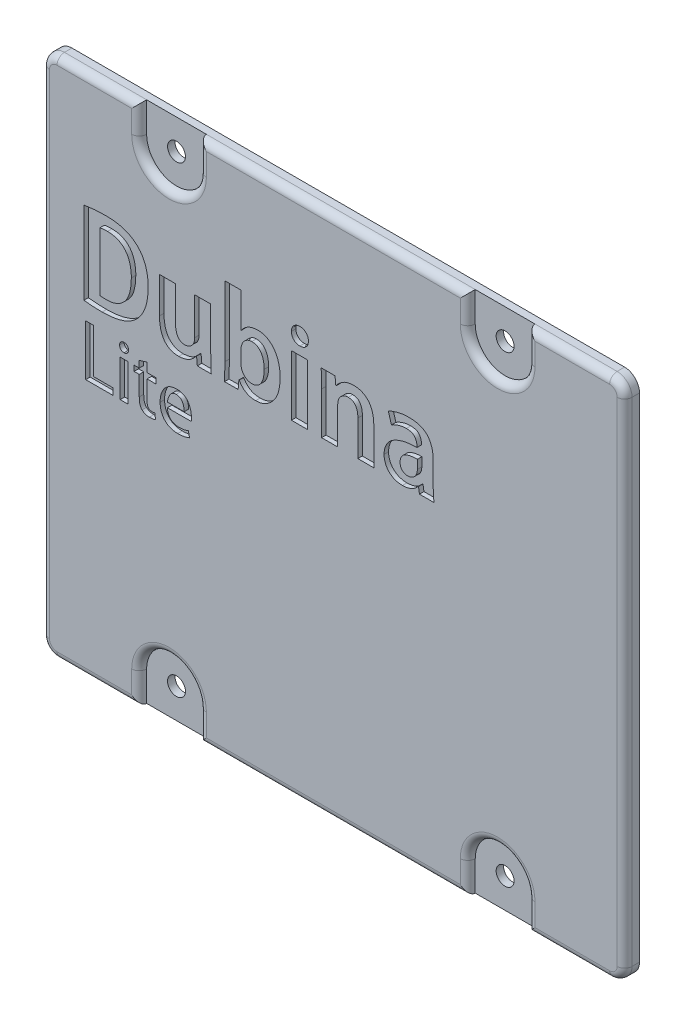
from build123d import *

# Parameters (mm, degrees)
EXTRUDE_1_DEPTH     = 2
SKETCH_2_3_R        = 1.2
EXTRUDE_2_DEPTH     = 1
FILLET_1_R          = 1
SKETCH_3_W          = 2.140804471
SKETCH_3_H          = 8.074367066
SKETCH_3_W_2        = 1.045585638
SKETCH_3_H_2        = 4.934335429
CUT_EXTRUDE_1_DEPTH = 0.6


with BuildPart() as part:
    # Эскиз2 → Бобышка-Вытянуть1 (new body)
    with BuildSketch(Plane.XY):
        with BuildLine():
            Line((-26, 35), (-37, 35))
            ThreePointArc((-37, 35), (-38.414213562, 34.414213562), (-39, 33))
            Line((-39, 33), (-39, -33))
            ThreePointArc((-39, -33), (-38.414213562, -34.414213562), (-37, -35))
            Line((-37, -35), (-26, -35))
            Line((-26, -35), (-26, -31))
            ThreePointArc((-26, -31), (-22, -27), (-18, -31))
            Line((-18, -31), (-18, -35))
            Line((-18, -35), (18, -35))
            Line((18, -35), (18, -31))
            ThreePointArc((18, -31), (22, -27), (26, -31))
            Line((26, -31), (26, -35))
            Line((26, -35), (37, -35))
            ThreePointArc((37, -35), (38.414213562, -34.414213562), (39, -33))
            Line((39, -33), (39, 33))
            ThreePointArc((39, 33), (38.414213562, 34.414213562), (37, 35))
            Line((37, 35), (26, 35))
            Line((26, 35), (26, 31))
            ThreePointArc((26, 31), (22, 27), (18, 31))
            Line((18, 31), (18, 35))
            Line((18, 35), (-18, 35))
            Line((-18, 35), (-18, 31))
            ThreePointArc((-18, 31), (-22, 27), (-26, 31))
            Line((-26, 31), (-26, 35))
        make_face()
    extrude(amount=EXTRUDE_1_DEPTH)

    # Эскиз2<3> → Бобышка-Вытянуть2 (add)
    # profile 1 of 4: a face of its own
    with BuildSketch(Plane.XY):
        with BuildLine():
            Line((-26, -31), (-26, -35))
            Line((-26, -35), (-18, -35))
            Line((-18, -35), (-18, -31))
            ThreePointArc((-18, -31), (-22, -27), (-26, -31))
        make_face()
        with Locations((-22, -31)):
            Circle(SKETCH_2_3_R, mode=Mode.SUBTRACT)
    # profile 2 of 4: a face of its own
    with BuildSketch(Plane.XY):
        with BuildLine():
            Line((18, -31), (18, -35))
            Line((18, -35), (26, -35))
            Line((26, -35), (26, -31))
            ThreePointArc((26, -31), (22, -27), (18, -31))
        make_face()
        with Locations((22, -31)):
            Circle(SKETCH_2_3_R, mode=Mode.SUBTRACT)
    # profile 3 of 4: a face of its own
    with BuildSketch(Plane.XY):
        with BuildLine():
            Line((26, 35), (18, 35))
            Line((18, 35), (18, 31))
            ThreePointArc((18, 31), (22, 27), (26, 31))
            Line((26, 31), (26, 35))
        make_face()
        with Locations((22, 31)):
            Circle(SKETCH_2_3_R, mode=Mode.SUBTRACT)
    # profile 4 of 4: a face of its own
    with BuildSketch(Plane.XY):
        with BuildLine():
            Line((-18, 35), (-26, 35))
            Line((-26, 35), (-26, 31))
            ThreePointArc((-26, 31), (-22, 27), (-18, 31))
            Line((-18, 31), (-18, 35))
        make_face()
        with Locations((-22, 31)):
            Circle(SKETCH_2_3_R, mode=Mode.SUBTRACT)
    extrude(amount=EXTRUDE_2_DEPTH)

    # Скругление1
    fillet_1_edges = [part.edges().sort_by_distance(p)[0] for p in [
        (-31.5, 35, 2),
        (-26, 33, 2),
        (-22, 27, 2),
        (-18, 33, 2),
        (0, 35, 2),
        (18, 33, 2),
        (22, 27, 2),
        (26, 33, 2),
        (31.5, 35, 2),
        (39, 0, 2),
        (31.5, -35, 2),
        (26, -33, 2),
        (22, -27, 2),
        (18, -33, 2),
        (0, -35, 2),
        (-18, -33, 2),
        (-22, -27, 2),
        (-26, -33, 2),
        (-31.5, -35, 2),
        (-38.414213562, 34.414213562, 2),
        (38.414213562, 34.414213562, 2),
        (38.414213562, -34.414213562, 2),
        (-38.414213562, -34.414213562, 2),
        (-39, 0, 2),
    ]]
    fillet(fillet_1_edges, radius=FILLET_1_R - 0.0001)  # a hair under: the kernel refuses the full size

    # Эскиз3 → Вырез-Вытянуть1 (cut)
    # profile 1 of 12: a face of its own
    with BuildSketch(Plane.XY.offset(2)):
        with BuildLine():
            add(Edge.make_bspline(
                [(-33.393138538, 8.551452839), (-33.318030964, 8.541044655), (-33.159637509, 8.519094961), (-32.910901713, 8.492266855), (-32.63963818, 8.46970589), (-32.346804749, 8.448066403), (-32.032064953, 8.431786433), (-31.695602907, 8.418995646), (-31.338044059, 8.41123396), (-31.092197084, 8.407392867), (-30.965769964, 8.40541758)],
                knots=[0, 0, 0, 0, 0.747798485, 1.577023202, 2.466955376, 3.432305679, 4.472841868, 5.575028817, 6.752955478, 8, 8, 8, 8], degree=3))
            add(Edge.make_bspline(
                [(-30.965769964, 8.40541758), (-30.730327991, 8.409248475), (-30.271198838, 8.416719003), (-29.602997505, 8.480841027), (-28.973494521, 8.58450489), (-28.385542019, 8.733650196), (-27.838633629, 8.923449635), (-27.33908479, 9.161868004), (-26.879926511, 9.436459292), (-26.611943507, 9.661788615), (-26.479777506, 9.772918334)],
                knots=[0, 0, 0, 0, 1.17842423, 2.298013867, 3.356996017, 4.369259479, 5.331192529, 6.249700563, 7.136773321, 8, 8, 8, 8], degree=3))
            add(Edge.make_bspline(
                [(-26.479777506, 9.772918334), (-26.42442458, 9.822878728), (-26.311908631, 9.924433273), (-26.150554082, 10.091364319), (-25.998608994, 10.278053983), (-25.84656794, 10.477391819), (-25.708164035, 10.698774065), (-25.566686543, 10.932064415), (-25.435870065, 11.184966624), (-25.30797249, 11.4539149), (-25.188579404, 11.741663319), (-25.089502015, 12.053234884), (-24.999436099, 12.383830551), (-24.930132654, 12.736998966), (-24.869260561, 13.11056633), (-24.829989895, 13.506132916), (-24.798093338, 13.922693804), (-24.792673044, 14.207571767), (-24.789892136, 14.353729797)],
                knots=[0, 0, 0, 0, 0.711529635, 1.446327024, 2.212730038, 3.007707617, 3.836959069, 4.702581573, 5.611055214, 6.552559085, 7.54462654, 8.581167827, 9.670545423, 10.812911411, 12.014096724, 13.281372547, 14.605194915, 16, 16, 16, 16], degree=3))
            add(Edge.make_bspline(
                [(-24.789892136, 14.353729797), (-24.791799031, 14.47807321), (-24.795529354, 14.721317296), (-24.816289673, 15.079235854), (-24.852778376, 15.422842491), (-24.899650411, 15.752975283), (-24.963917224, 16.06843176), (-25.03926506, 16.369531355), (-25.127070629, 16.657084811), (-25.23109106, 16.929651274), (-25.347334081, 17.1887836), (-25.473260981, 17.436471654), (-25.612961956, 17.670153921), (-25.762456793, 17.892531842), (-25.924341095, 18.100999957), (-26.09895528, 18.29520502), (-26.281282549, 18.480377501), (-26.413560216, 18.592066442), (-26.479777506, 18.647977157)],
                knots=[0, 0, 0, 0, 1.250196122, 2.445668869, 3.60292861, 4.723409941, 5.796680955, 6.837975795, 7.843086112, 8.817515314, 9.76895262, 10.69744629, 11.609358382, 12.504409608, 13.39005195, 14.260302496, 15.129119398, 16, 16, 16, 16], degree=3))
            add(Edge.make_bspline(
                [(-26.479777506, 18.647977157), (-26.598595544, 18.742761407), (-26.83871198, 18.934308555), (-27.241309456, 19.174139821), (-27.679844374, 19.375887665), (-28.156207151, 19.54427422), (-28.675941132, 19.670995188), (-29.242198664, 19.76352234), (-29.857102303, 19.817302649), (-30.28366833, 19.824318113), (-30.504317475, 19.827946991)],
                knots=[0, 0, 0, 0, 0.850789701, 1.719339872, 2.61723906, 3.551911928, 4.545442216, 5.610282156, 6.763874371, 8, 8, 8, 8], degree=3))
            add(Edge.make_bspline(
                [(-30.504317475, 19.827946991), (-30.770593889, 19.82554478), (-31.290226405, 19.820856917), (-31.929365663, 19.77968562), (-32.416063916, 19.735990418), (-32.757845589, 19.692212876), (-33.082776308, 19.647512735), (-33.29280261, 19.610168021), (-33.395243569, 19.591953025)],
                knots=[0, 0, 0, 0, 1.650018419, 3.219974348, 3.967566001, 4.678084243, 5.355231624, 6, 6, 6, 6], degree=3))
            Line((-33.395243569, 19.591953025), (-33.393138538, 8.551452839))
        make_face()
        with BuildLine():
            add(Edge.make_bspline(
                [(-31.252334067, 18.031715359), (-31.188537733, 18.043403777), (-31.04826475, 18.06910383), (-30.815799289, 18.091651715), (-30.543982864, 18.111999216), (-30.349146054, 18.115253599), (-30.24514553, 18.116990732)],
                knots=[0, 0, 0, 0, 0.76869223, 1.690171609, 2.76705349, 4, 4, 4, 4], degree=3))
            add(Edge.make_bspline(
                [(-30.24514553, 18.116990732), (-30.123506281, 18.114287351), (-29.886406197, 18.109017902), (-29.541218959, 18.064340125), (-29.217170387, 17.989628458), (-28.911143589, 17.891430244), (-28.629459778, 17.752367435), (-28.364313148, 17.592107554), (-28.122506467, 17.397023439), (-27.900110499, 17.175580067), (-27.700699455, 16.922844384), (-27.527366677, 16.639200271), (-27.383809338, 16.324696505), (-27.258419619, 15.983399975), (-27.169902154, 15.609371275), (-27.098941346, 15.207888026), (-27.057524719, 14.775987263), (-27.050311522, 14.478132768), (-27.046584444, 14.324230551)],
                knots=[0, 0, 0, 0, 1.034636826, 2.016721417, 2.954616098, 3.861659027, 4.743652532, 5.62095741, 6.492606741, 7.379948462, 8.28614458, 9.224914536, 10.200706863, 11.223314941, 12.31319917, 13.465574242, 14.690455408, 16, 16, 16, 16], degree=3))
            add(Edge.make_bspline(
                [(-27.046584444, 14.324230551), (-27.050817963, 14.147139134), (-27.058997428, 13.804985752), (-27.104805999, 13.309910726), (-27.180807831, 12.852524884), (-27.280006469, 12.430208269), (-27.410534116, 12.045635918), (-27.568239793, 11.696457744), (-27.756104566, 11.385480056), (-27.970750393, 11.110458448), (-28.209820239, 10.872086589), (-28.468857931, 10.666230065), (-28.746478472, 10.491263748), (-29.046382057, 10.351984282), (-29.36531728, 10.24504382), (-29.703278376, 10.168424061), (-30.061427953, 10.126219447), (-30.306844506, 10.123889656), (-30.43267645, 10.122695106)],
                knots=[0, 0, 0, 0, 1.382790342, 2.671650606, 3.877892401, 5.000458499, 6.054825918, 7.043745429, 7.986092149, 8.88452668, 9.760866288, 10.615577842, 11.46308158, 12.316807429, 13.190810493, 14.084799087, 15.018022824, 16, 16, 16, 16], degree=3))
            add(Edge.make_bspline(
                [(-30.43267645, 10.122695106), (-30.507841092, 10.121089792), (-30.653306169, 10.117983051), (-30.86479072, 10.128225769), (-31.063247463, 10.141101133), (-31.190598922, 10.15850651), (-31.252334067, 10.166943975)],
                knots=[0, 0, 0, 0, 1.0974001, 2.123783006, 3.090481336, 4, 4, 4, 4], degree=3))
            Line((-31.252334067, 10.166943975), (-31.252334067, 18.031715359))
        make_face(mode=Mode.SUBTRACT)
    # profile 2 of 12: a face of its own
    with BuildSketch(Plane.XY.offset(2)):
        with BuildLine():
            Line((-18.559232052, 16.606207927), (-18.559232052, 11.63409728))
            add(Edge.make_bspline(
                [(-18.559232052, 11.63409728), (-18.566794255, 11.524487696), (-18.581277232, 11.314565676), (-18.660845772, 11.018992172), (-18.782919933, 10.756861624), (-18.955326415, 10.538607355), (-19.15803687, 10.361957412), (-19.38521809, 10.233382725), (-19.632676016, 10.151544277), (-19.80530386, 10.13940076), (-19.893017325, 10.133230551)],
                knots=[0, 0, 0, 0, 1.179015692, 2.25802659, 3.271398766, 4.266941286, 5.225354467, 6.145233723, 7.057579747, 8, 8, 8, 8], degree=3))
            add(Edge.make_bspline(
                [(-19.893017325, 10.133230551), (-19.946467553, 10.135725089), (-20.050450482, 10.140578003), (-20.201198575, 10.164542928), (-20.339343934, 10.210313415), (-20.46648561, 10.268846312), (-20.582271312, 10.34310891), (-20.68444158, 10.435638816), (-20.775736436, 10.544179259), (-20.854799433, 10.668921111), (-20.924534535, 10.806560652), (-20.983521503, 10.956904298), (-21.031291497, 11.120061309), (-21.071273992, 11.295295199), (-21.102480527, 11.483184493), (-21.125744487, 11.682834131), (-21.138586666, 11.895287153), (-21.138402192, 12.04083179), (-21.138306917, 12.11600129)],
                knots=[0, 0, 0, 0, 0.970111335, 1.887270113, 2.757316712, 3.600661993, 4.42030127, 5.241127285, 6.090797025, 6.984664766, 7.913162656, 8.885278701, 9.908852515, 10.993376472, 12.142964809, 13.361072668, 14.637072075, 16, 16, 16, 16], degree=3))
            Line((-21.138306917, 12.11600129), (-21.138306917, 16.606207927))
            Line((-21.138306917, 16.606207927), (-23.279111388, 16.606207927))
            Line((-23.279111388, 16.606207927), (-23.279111388, 11.798437875))
            add(Edge.make_bspline(
                [(-23.279111388, 11.798437875), (-23.277018338, 11.653441202), (-23.272979591, 11.373655786), (-23.232836744, 10.970507003), (-23.177514586, 10.597933484), (-23.100754041, 10.254884318), (-22.999729138, 9.943494991), (-22.880316945, 9.661178121), (-22.735956294, 9.411785225), (-22.573805862, 9.190064642), (-22.390230863, 9.0000533), (-22.194180569, 8.833953753), (-21.980901613, 8.695563214), (-21.752705793, 8.584295148), (-21.510440102, 8.496941726), (-21.253198083, 8.436283103), (-20.981375389, 8.39923432), (-20.794971837, 8.397746833), (-20.700032407, 8.396989224)],
                knots=[0, 0, 0, 0, 1.433410501, 2.765907269, 4.002642214, 5.156811599, 6.237479393, 7.236132151, 8.182067156, 9.08085115, 9.945465735, 10.788525471, 11.616923183, 12.452510876, 13.293966855, 14.15819078, 15.061926052, 16, 16, 16, 16], degree=3))
            add(Edge.make_bspline(
                [(-20.700032407, 8.396989224), (-20.623429128, 8.400455951), (-20.473439885, 8.407243803), (-20.254425478, 8.429787293), (-20.047014664, 8.466187848), (-19.851257026, 8.512056061), (-19.666290196, 8.568589772), (-19.493463968, 8.638812445), (-19.33078813, 8.717974047), (-19.135268096, 8.838003884), (-18.918779965, 8.998250895), (-18.690755445, 9.196593308), (-18.500965349, 9.398158919), (-18.40360824, 9.544670426), (-18.356949451, 9.61488666)],
                knots=[0, 0, 0, 0, 1.002239885, 1.962385977, 2.8755572, 3.752951768, 4.589276476, 5.400792547, 6.189126677, 6.951201867, 8.396379851, 9.703982279, 10.899624208, 12, 12, 12, 12], degree=3))
            Line((-18.356949451, 9.61488666), (-18.313315836, 9.616600727))
            Line((-18.313315836, 9.616600727), (-18.212056218, 8.531840861))
            Line((-18.212056218, 8.531840861), (-16.345607491, 8.531840861))
            add(Edge.make_bspline(
                [(-16.345607491, 8.531840861), (-16.355801559, 8.710912621), (-16.377180405, 9.086459228), (-16.396854909, 9.676595244), (-16.411283956, 10.31860388), (-16.417374397, 10.763946089), (-16.42053467, 10.995029948)],
                knots=[0, 0, 0, 0, 0.873285086, 1.831440378, 2.874754927, 4, 4, 4, 4], degree=3))
            Line((-16.42053467, 10.995029948), (-16.418429639, 16.606207927))
            Line((-16.418429639, 16.606207927), (-18.559232052, 16.606207927))
        make_face()
    # profile 3 of 12: a face of its own
    with BuildSketch(Plane.XY.offset(2)):
        with BuildLine():
            Line((-12.372816721, 20.247255643), (-14.513621192, 20.247255643))
            Line((-14.513621192, 20.247255643), (-14.513621192, 10.877677026))
            add(Edge.make_bspline(
                [(-14.513621192, 10.877677026), (-14.51522432, 10.660425309), (-14.518382581, 10.232425805), (-14.529502972, 9.704751272), (-14.540073498, 9.30228061), (-14.551269805, 9.025592372), (-14.561550927, 8.770623565), (-14.569036072, 8.607695166), (-14.572617626, 8.52973583)],
                knots=[0, 0, 0, 0, 1.664880021, 3.279918044, 4.044519703, 4.750125368, 5.401949591, 6, 6, 6, 6], degree=3))
            Line((-14.572617626, 8.52973583), (-12.748810701, 8.531840861))
            Line((-12.748810701, 8.531840861), (-12.647551083, 9.687478345))
            Line((-12.647551083, 9.687478345), (-12.604154104, 9.687478345))
            add(Edge.make_bspline(
                [(-12.604154104, 9.687478345), (-12.538992106, 9.579166388), (-12.413346963, 9.370319643), (-12.184990941, 9.098163985), (-11.936344518, 8.872241871), (-11.663183425, 8.696460389), (-11.37251717, 8.563028444), (-11.065488805, 8.470208177), (-10.743328738, 8.413782678), (-10.523024183, 8.408235407), (-10.411116872, 8.40541758)],
                knots=[0, 0, 0, 0, 1.131224551, 2.181223318, 3.170642443, 4.13078333, 5.079824189, 6.02748669, 6.998029518, 8, 8, 8, 8], degree=3))
            add(Edge.make_bspline(
                [(-10.411116872, 8.40541758), (-10.30419891, 8.408861133), (-10.092072629, 8.415693175), (-9.779109786, 8.464100568), (-9.476988904, 8.549970645), (-9.186010258, 8.668207299), (-8.904463009, 8.819490195), (-8.635388903, 9.005588363), (-8.376257626, 9.225503572), (-8.128019641, 9.476345175), (-7.900567959, 9.763352196), (-7.698217989, 10.083964801), (-7.528953964, 10.440632547), (-7.384927601, 10.828773232), (-7.274669489, 11.251956868), (-7.190766906, 11.707518464), (-7.136277157, 12.197687878), (-7.122652521, 12.535879337), (-7.115629693, 12.710200385)],
                knots=[0, 0, 0, 0, 0.847449944, 1.68134896, 2.502719537, 3.331902851, 4.166396421, 5.031225821, 5.920181802, 6.857197951, 7.824106615, 8.817361735, 9.855764383, 10.947927019, 12.09450585, 13.317559317, 14.617333883, 16, 16, 16, 16], degree=3))
            add(Edge.make_bspline(
                [(-7.115629693, 12.710200385), (-7.119543561, 12.856377627), (-7.127197481, 13.142240272), (-7.16715244, 13.560465746), (-7.232399201, 13.956698042), (-7.319876765, 14.331178463), (-7.433915057, 14.682988308), (-7.573508284, 15.0125614), (-7.735387073, 15.321236756), (-7.920622091, 15.60575603), (-8.125786594, 15.863641361), (-8.353020054, 16.088108946), (-8.596042058, 16.281481752), (-8.857042331, 16.441976248), (-9.138017105, 16.563766175), (-9.434881852, 16.654179148), (-9.749137578, 16.715982748), (-9.965522763, 16.725607956), (-10.076089723, 16.730526177)],
                knots=[0, 0, 0, 0, 1.258613326, 2.461330713, 3.613433494, 4.713391422, 5.768892021, 6.793100615, 7.791148573, 8.765544853, 9.711748599, 10.622452917, 11.509175615, 12.380257356, 13.252052325, 14.137599147, 15.048363683, 16, 16, 16, 16], degree=3))
            add(Edge.make_bspline(
                [(-10.076089723, 16.730526177), (-10.202020167, 16.726201539), (-10.44608576, 16.717819966), (-10.799628432, 16.661078785), (-11.125873524, 16.563934875), (-11.425956491, 16.430168221), (-11.697835953, 16.263280793), (-11.944437372, 16.066891127), (-12.162673919, 15.839053554), (-12.284296929, 15.666686928), (-12.345424564, 15.580055589)],
                knots=[0, 0, 0, 0, 1.137196293, 2.203998325, 3.223492524, 4.203095137, 5.162612269, 6.096781389, 7.043443732, 8, 8, 8, 8], degree=3))
            Line((-12.345424564, 15.580055589), (-12.372816721, 15.581650309))
            Line((-12.372816721, 15.581650309), (-12.372816721, 20.247255643))
        make_face()
        with BuildLine():
            add(Edge.make_bspline(
                [(-12.372816721, 13.308025155), (-12.369330119, 13.370785007), (-12.362503885, 13.493659197), (-12.340114966, 13.673826386), (-12.302137968, 13.844392841), (-12.251013147, 14.004688602), (-12.190875379, 14.156109073), (-12.114180522, 14.295466117), (-12.024853754, 14.425061704), (-11.892341848, 14.582234609), (-11.707320746, 14.748941772), (-11.46013863, 14.899506173), (-11.191312476, 14.991506668), (-11.004591856, 15.005963407), (-10.910496963, 15.013248651)],
                knots=[0, 0, 0, 0, 0.908426032, 1.778559225, 2.620947371, 3.430072183, 4.208687216, 4.971927617, 5.723807717, 6.480334157, 7.93974638, 9.30127749, 10.640021615, 12, 12, 12, 12], degree=3))
            add(Edge.make_bspline(
                [(-10.910496963, 15.013248651), (-10.842912833, 15.009105026), (-10.711760151, 15.001063974), (-10.521321705, 14.964694068), (-10.344522008, 14.907932865), (-10.179940664, 14.832301269), (-10.030575166, 14.732936962), (-9.893484555, 14.615177111), (-9.769752252, 14.476101573), (-9.661892416, 14.317684167), (-9.564335761, 14.145315872), (-9.483840331, 13.958513363), (-9.410340143, 13.762426676), (-9.35489295, 13.553224116), (-9.3104255, 13.333702181), (-9.27913688, 13.102851719), (-9.259893699, 12.860836653), (-9.257601182, 12.695487547), (-9.256432106, 12.611167203)],
                knots=[0, 0, 0, 0, 0.993416888, 1.927808926, 2.837694666, 3.714244227, 4.578022629, 5.462783605, 6.361142406, 7.302281864, 8.271861941, 9.264475635, 10.285606373, 11.343816068, 12.43794596, 13.572585426, 14.762131615, 16, 16, 16, 16], degree=3))
            add(Edge.make_bspline(
                [(-9.256432106, 12.611167203), (-9.258623114, 12.517042255), (-9.262894954, 12.333525433), (-9.279427871, 12.065747277), (-9.317676131, 11.814484589), (-9.361244576, 11.57780026), (-9.424588203, 11.358407646), (-9.493294017, 11.152058113), (-9.584246941, 10.964912576), (-9.681480216, 10.79124063), (-9.79316706, 10.636432197), (-9.918739406, 10.502168664), (-10.056455712, 10.388044741), (-10.204480122, 10.292159877), (-10.364574244, 10.217145537), (-10.536538064, 10.165697481), (-10.719434281, 10.130144013), (-10.845703756, 10.125221181), (-10.910496963, 10.122695106)],
                knots=[0, 0, 0, 0, 1.348300097, 2.628800938, 3.837789757, 4.985751026, 6.071630837, 7.105398901, 8.09517776, 9.04575416, 9.953046414, 10.8211399, 11.671039994, 12.507987558, 13.340390576, 14.192964346, 15.072747904, 16, 16, 16, 16], degree=3))
            add(Edge.make_bspline(
                [(-10.910496963, 10.122695106), (-10.963991489, 10.125889759), (-11.068704729, 10.132143155), (-11.221502499, 10.15870416), (-11.367474607, 10.194318787), (-11.503329639, 10.251546015), (-11.632184953, 10.318363732), (-11.753532302, 10.398957648), (-11.865861916, 10.494543695), (-12.002370363, 10.640778195), (-12.14912298, 10.84686843), (-12.277462392, 11.12526357), (-12.354487162, 11.432787038), (-12.366572695, 11.64708071), (-12.372816721, 11.757796162)],
                knots=[0, 0, 0, 0, 0.788858868, 1.544157359, 2.282030985, 2.996834577, 3.70961312, 4.418475268, 5.137907402, 5.877230683, 7.361586745, 8.843126943, 10.368992307, 12, 12, 12, 12], degree=3))
            Line((-12.372816721, 11.757796162), (-12.372816721, 13.308025155))
        make_face(mode=Mode.SUBTRACT)
    # profile 4 of 12: a face of its own
    with BuildSketch(Plane.XY.offset(2)):
        with BuildLine():
            add(Edge.make_bspline(
                [(-3.337619134, 18.83963789), (-3.342605214, 18.920084543), (-3.352236553, 19.07547896), (-3.4111892, 19.29707262), (-3.512418009, 19.492334349), (-3.648962999, 19.66037178), (-3.816229876, 19.799433125), (-4.015013316, 19.899443942), (-4.240704538, 19.961875025), (-4.40057385, 19.970795242), (-4.483875545, 19.975443221)],
                knots=[0, 0, 0, 0, 1.067678627, 2.062376614, 3.016841452, 3.964320136, 4.917692493, 5.880446744, 6.895583054, 8, 8, 8, 8], degree=3))
            add(Edge.make_bspline(
                [(-4.483875545, 19.975443221), (-4.563684739, 19.970737216), (-4.718036819, 19.961635739), (-4.937109717, 19.898594007), (-5.133135956, 19.799006218), (-5.299449513, 19.659618388), (-5.439477038, 19.493750376), (-5.53577317, 19.295626112), (-5.602567078, 19.075726743), (-5.611006481, 18.918919901), (-5.615382332, 18.837615166)],
                knots=[0, 0, 0, 0, 1.066831069, 2.06326596, 3.025668899, 3.98697027, 4.948271641, 5.90639895, 6.914462685, 8, 8, 8, 8], degree=3))
            add(Edge.make_bspline(
                [(-5.615382332, 18.837615166), (-5.610416958, 18.758570768), (-5.600784716, 18.605233911), (-5.540931353, 18.386568421), (-5.442566064, 18.190510844), (-5.306182794, 18.021237125), (-5.139381054, 17.88088427), (-4.943480561, 17.777711093), (-4.721304322, 17.716230388), (-4.565035271, 17.705407879), (-4.483875545, 17.699787112)],
                knots=[0, 0, 0, 0, 1.057718482, 2.051849729, 3.010193927, 3.97308998, 4.940607778, 5.907577615, 6.913281758, 8, 8, 8, 8], degree=3))
            add(Edge.make_bspline(
                [(-4.483875545, 17.699787112), (-4.403434645, 17.703856375), (-4.247965182, 17.711721108), (-4.026904369, 17.771581731), (-3.831026085, 17.871401112), (-3.658455171, 18.003828597), (-3.518966173, 18.171820363), (-3.414587472, 18.368543996), (-3.354053381, 18.594698434), (-3.34325037, 18.754379144), (-3.337619134, 18.837615166)],
                knots=[0, 0, 0, 0, 1.065625004, 2.059551157, 3.009038306, 3.964579149, 4.923155116, 5.881188186, 6.895536802, 8, 8, 8, 8], degree=3))
            Line((-3.337619134, 18.837615166), (-3.337619134, 18.83963789))
        make_face()
    # profile 5 of 12: a face of its own
    with BuildSketch(Plane.XY.offset(2)):
        with Locations((-4.542875066, 12.569024394)):
            Rectangle(SKETCH_3_W, SKETCH_3_H)
    # profile 6 of 12: a face of its own
    with BuildSketch(Plane.XY.offset(2)):
        with BuildLine():
            Line((0.327334988, 15.51654661), (0.226075369, 16.606207927))
            Line((0.226075369, 16.606207927), (-1.625924159, 16.606207927))
            add(Edge.make_bspline(
                [(-1.625924159, 16.606207927), (-1.617978865, 16.42571828), (-1.601442865, 16.050077454), (-1.585118114, 15.464946011), (-1.575049306, 14.836283021), (-1.571570166, 14.402898493), (-1.569771472, 14.178841411)],
                knots=[0, 0, 0, 0, 0.89282334, 1.858172496, 2.892688618, 4, 4, 4, 4], degree=3))
            Line((-1.569771472, 14.178841411), (-1.567666441, 8.531840861))
            Line((-1.567666441, 8.531840861), (0.57313803, 8.531840861))
            Line((0.57313803, 8.531840861), (0.57313803, 13.338363944))
            add(Edge.make_bspline(
                [(0.57313803, 13.338363944), (0.577108197, 13.410697093), (0.584808189, 13.550984548), (0.611480952, 13.753371497), (0.653655881, 13.939413497), (0.708464296, 14.10950466), (0.775490647, 14.263803174), (0.855427769, 14.402804363), (0.951550226, 14.523914123), (1.092574255, 14.660714368), (1.28143877, 14.798506731), (1.518186009, 14.919056464), (1.759764961, 14.99414392), (1.92327966, 14.999884525), (2.003851454, 15.002713206)],
                knots=[0, 0, 0, 0, 1.062159612, 2.060019103, 2.989565638, 3.856020944, 4.677018154, 5.45256044, 6.200596125, 6.936260821, 8.328943673, 9.609547682, 10.822105713, 12, 12, 12, 12], degree=3))
            add(Edge.make_bspline(
                [(2.003851454, 15.002713206), (2.060106598, 14.999363786), (2.169622151, 14.992843252), (2.327747607, 14.969069239), (2.472563168, 14.926132357), (2.604537238, 14.869331454), (2.723673161, 14.797035636), (2.830935545, 14.709853042), (2.923167687, 14.605663272), (3.031321987, 14.447919665), (3.138195495, 14.222294105), (3.228883153, 13.922713445), (3.278611841, 13.589823824), (3.282784678, 13.357940987), (3.284961559, 13.236972633)],
                knots=[0, 0, 0, 0, 0.819984559, 1.596317342, 2.320790788, 3.011982078, 3.681600685, 4.342503711, 5.015623514, 5.698910004, 7.120561833, 8.627264371, 10.240515412, 12, 12, 12, 12], degree=3))
            Line((3.284961559, 13.236972633), (3.287066591, 8.531840861))
            Line((3.287066591, 8.531840861), (5.427869004, 8.531840861))
            Line((5.427869004, 8.531840861), (5.427869004, 13.46954258))
            add(Edge.make_bspline(
                [(5.427869004, 13.46954258), (5.423203476, 13.604935502), (5.414158764, 13.867411719), (5.373891951, 14.247253573), (5.313434627, 14.600091088), (5.232799668, 14.925732452), (5.126818617, 15.223568065), (4.998928197, 15.493644308), (4.848908364, 15.73721911), (4.674393714, 15.950113788), (4.484333817, 16.138644761), (4.280035567, 16.301112341), (4.062096748, 16.437698842), (3.832496007, 16.549228433), (3.589680157, 16.636924422), (3.333767137, 16.69721622), (3.064808898, 16.734146252), (2.881224216, 16.737331607), (2.787688558, 16.738954533)],
                knots=[0, 0, 0, 0, 1.367692787, 2.65144457, 3.853626784, 4.980360652, 6.034744203, 7.040411954, 7.992955059, 8.915668451, 9.813401669, 10.691790595, 11.545846867, 12.405480468, 13.264733617, 14.147236264, 15.056024321, 16, 16, 16, 16], degree=3))
            add(Edge.make_bspline(
                [(2.787688558, 16.738954533), (2.641274285, 16.73576857), (2.358577748, 16.729617117), (1.954146299, 16.658506027), (1.585092246, 16.545095555), (1.261470475, 16.375666388), (0.979447897, 16.17894509), (0.73234548, 15.973183549), (0.525888925, 15.754308357), (0.420016867, 15.592896404), (0.368750398, 15.51473583)],
                knots=[0, 0, 0, 0, 1.237745281, 2.389837407, 3.463172556, 4.491936586, 5.466326472, 6.368928413, 7.21018556, 8, 8, 8, 8], degree=3))
            Line((0.368750398, 15.51473583), (0.327334988, 15.51654661))
        make_face()
    # profile 7 of 12: a face of its own
    with BuildSketch(Plane.XY.offset(2)):
        with BuildLine():
            add(Edge.make_bspline(
                [(7.782452468, 14.686756858), (7.850978578, 14.729386662), (7.990762641, 14.816345738), (8.216050662, 14.925155649), (8.453901326, 15.025933664), (8.704503334, 15.11146855), (8.965192324, 15.179976034), (9.229989526, 15.234565474), (9.500266184, 15.263111181), (9.68132671, 15.269298513), (9.772688558, 15.272420596)],
                knots=[0, 0, 0, 0, 0.921222762, 1.879170737, 2.853605547, 3.870952631, 4.900374728, 5.930921604, 6.955957829, 8, 8, 8, 8], degree=3))
            add(Edge.make_bspline(
                [(9.772688558, 15.272420596), (9.840210058, 15.270872848), (9.970751241, 15.267880544), (10.15709742, 15.243212631), (10.327902384, 15.211753816), (10.479702271, 15.161976481), (10.617045934, 15.1043938), (10.73495549, 15.030145633), (10.837432443, 14.944352224), (10.948498459, 14.810956043), (11.058858373, 14.619876674), (11.145832565, 14.362632279), (11.198951834, 14.077791519), (11.197723086, 13.878478396), (11.197080715, 13.774280325)],
                knots=[0, 0, 0, 0, 1.015501891, 1.963297894, 2.825560386, 3.624409854, 4.362726652, 5.060679176, 5.712965577, 6.365251979, 7.663128898, 9.006844189, 10.435220624, 12, 12, 12, 12], degree=3))
            add(Edge.make_bspline(
                [(11.197080715, 13.774280325), (11.039693827, 13.772475725), (10.731564127, 13.768942705), (10.28055347, 13.73496463), (9.852325436, 13.677768263), (9.44607973, 13.601951557), (9.06389904, 13.496787197), (8.701762574, 13.374821249), (8.3642304, 13.222913394), (8.047100191, 13.055033543), (7.760518496, 12.859937912), (7.50754553, 12.639755421), (7.296243503, 12.390479148), (7.11824757, 12.117907044), (6.979747852, 11.818676861), (6.875779911, 11.495547397), (6.809443767, 11.147222909), (6.797365284, 10.906124628), (6.791157638, 10.78221396)],
                knots=[0, 0, 0, 0, 1.262205049, 2.471126202, 3.624785542, 4.726306887, 5.782663399, 6.801709071, 7.787818693, 8.74816751, 9.676318542, 10.562399853, 11.429455743, 12.288864775, 13.165892172, 14.065568705, 15.00581342, 16, 16, 16, 16], degree=3))
            add(Edge.make_bspline(
                [(6.791157638, 10.78221396), (6.793732877, 10.699199533), (6.798795621, 10.535998888), (6.834346665, 10.297232969), (6.885086817, 10.068632378), (6.961660902, 9.852746847), (7.049641493, 9.644287317), (7.166612914, 9.450154633), (7.298280323, 9.264247668), (7.450658871, 9.091138201), (7.62003724, 8.933345187), (7.807346295, 8.796028812), (8.008421715, 8.676325175), (8.22697296, 8.580422559), (8.459414674, 8.501695127), (8.707907936, 8.445082237), (8.971729978, 8.409432759), (9.153095661, 8.40120175), (9.24591631, 8.396989224)],
                knots=[0, 0, 0, 0, 1.039034809, 2.042670863, 3.017538516, 3.965866516, 4.906990884, 5.845111153, 6.796858029, 7.756494624, 8.727268264, 9.68935964, 10.659136981, 11.651147514, 12.671746341, 13.727687939, 14.837059593, 16, 16, 16, 16], degree=3))
            add(Edge.make_bspline(
                [(9.24591631, 8.396989224), (9.354941988, 8.400452696), (9.569073556, 8.407255118), (9.882877872, 8.454182408), (10.180881787, 8.532238167), (10.462549942, 8.63954808), (10.723477903, 8.776222416), (10.961898465, 8.93936803), (11.175923443, 9.130235011), (11.296551449, 9.27745731), (11.357219478, 9.351500536)],
                knots=[0, 0, 0, 0, 1.089521257, 2.139871092, 3.163177725, 4.163102539, 5.145903192, 6.1000057, 7.044426644, 8, 8, 8, 8], degree=3))
            Line((11.357219478, 9.351500536), (11.402997221, 9.351673383))
            Line((11.402997221, 9.351673383), (11.535225286, 8.531840861))
            Line((11.535225286, 8.531840861), (13.488109931, 8.531840861))
            add(Edge.make_bspline(
                [(13.488109931, 8.531840861), (13.477570784, 8.596388782), (13.4556308, 8.730762127), (13.431595284, 8.941057681), (13.40963693, 9.166464169), (13.391745623, 9.491130577), (13.372098014, 9.915976269), (13.370369315, 10.261030038), (13.369489463, 10.436651366)],
                knots=[0, 0, 0, 0, 0.616094179, 1.28256085, 1.993685948, 2.749466753, 4.34558259, 6, 6, 6, 6], degree=3))
            Line((13.369489463, 10.436651366), (13.371594494, 13.353708243))
            add(Edge.make_bspline(
                [(13.371594494, 13.353708243), (13.37166188, 13.469350921), (13.371794541, 13.697012257), (13.346766208, 14.032077843), (13.297712464, 14.352969168), (13.229873091, 14.660364924), (13.133481132, 14.95140201), (13.018385958, 15.229293938), (12.877394438, 15.491584492), (12.717606952, 15.741642793), (12.524521906, 15.970354096), (12.294332904, 16.169905701), (12.027807525, 16.339434702), (11.725217558, 16.477881288), (11.388261445, 16.589590797), (11.01463489, 16.670482386), (10.605709776, 16.723146816), (10.320697144, 16.733559727), (10.173035466, 16.738954533)],
                knots=[0, 0, 0, 0, 1.037939004, 2.043351001, 3.012684027, 3.950348011, 4.865589174, 5.761446226, 6.647171701, 7.535608735, 8.421289321, 9.324087164, 10.259862385, 11.247218489, 12.30401033, 13.440682476, 14.674047819, 16, 16, 16, 16], degree=3))
            add(Edge.make_bspline(
                [(10.173035466, 16.738954533), (10.021215328, 16.735321388), (9.725420776, 16.72824285), (9.295538096, 16.684907776), (8.891942239, 16.621078001), (8.518137356, 16.532072569), (8.177946939, 16.429039996), (7.872407539, 16.321806128), (7.604403019, 16.210744764), (7.443763004, 16.124198481), (7.368500021, 16.083649857)],
                knots=[0, 0, 0, 0, 1.252902983, 2.441058744, 3.56267823, 4.62278865, 5.609386748, 6.494886694, 7.294825038, 8, 8, 8, 8], degree=3))
            Line((7.368500021, 16.083649857), (7.782452468, 14.686756858))
        make_face()
        with BuildLine():
            add(Edge.make_bspline(
                [(11.256077149, 11.2702026), (11.251213123, 11.207913031), (11.241809326, 11.087486361), (11.215887169, 10.913757459), (11.172689128, 10.755588861), (11.121081905, 10.610780224), (11.054805026, 10.480821561), (10.977168124, 10.364021323), (10.885243621, 10.26152846), (10.749310258, 10.1468872), (10.571214404, 10.033287872), (10.354682478, 9.93457838), (10.142454186, 9.86935968), (9.999983132, 9.865432416), (9.930720232, 9.86352316)],
                knots=[0, 0, 0, 0, 1.043926595, 2.0182609, 2.929185394, 3.779426585, 4.582434006, 5.360352114, 6.116635953, 6.874011636, 8.325857533, 9.628293333, 10.846984866, 12, 12, 12, 12], degree=3))
            add(Edge.make_bspline(
                [(9.930720232, 9.86352316), (9.865033827, 9.865714254), (9.735783404, 9.870025644), (9.550784756, 9.923262269), (9.379707821, 10.006553803), (9.226821161, 10.125485627), (9.096468455, 10.281538334), (9.007086895, 10.481103304), (8.947216349, 10.715607209), (8.93862726, 10.885739492), (8.93406714, 10.976066147)],
                knots=[0, 0, 0, 0, 0.932689269, 1.835242495, 2.716319968, 3.628517603, 4.573510817, 5.580053048, 6.715201435, 8, 8, 8, 8], degree=3))
            add(Edge.make_bspline(
                [(8.93406714, 10.976066147), (8.938399396, 11.045878424), (8.946792123, 11.181123312), (8.991431275, 11.372675882), (9.048278765, 11.549390524), (9.132599946, 11.705729199), (9.233279623, 11.848249197), (9.360258224, 11.967272878), (9.503297416, 12.073829192), (9.725529988, 12.186236241), (10.029173885, 12.294073864), (10.415339196, 12.388126276), (10.826959037, 12.438790056), (11.109155516, 12.439915463), (11.253972117, 12.440492995)],
                knots=[0, 0, 0, 0, 0.812232766, 1.573510204, 2.281488938, 2.964950378, 3.63174977, 4.302044204, 4.980259673, 5.700253563, 7.189246091, 8.719149585, 10.31634467, 12, 12, 12, 12], degree=3))
            Line((11.253972117, 12.440492995), (11.256077149, 11.2702026))
        make_face(mode=Mode.SUBTRACT)
    # profile 8 of 12: a face of its own
    with BuildSketch(Plane.XY.offset(2)):
        Polygon((-29.486900788, 0.346747909), (-32.112543783, 0.346747909), (-32.112543783, 6.288035239), (-33.158129421, 6.288035239), (-33.158129421, -0.534015289), (-29.486900788, -0.534015289), align=None)
    # profile 9 of 12: a face of its own
    with BuildSketch(Plane.XY.offset(2)):
        with BuildLine():
            add(Edge.make_bspline(
                [(-27.415140062, 5.753026574), (-27.41808435, 5.795473689), (-27.423798948, 5.877859716), (-27.454498557, 5.995718711), (-27.507080925, 6.100647137), (-27.578270153, 6.191592098), (-27.666853251, 6.265731934), (-27.770430104, 6.321150046), (-27.889314594, 6.353305437), (-27.972935007, 6.358650184), (-28.016479848, 6.361433429)],
                knots=[0, 0, 0, 0, 1.064877965, 2.066832164, 3.02896069, 3.986568619, 4.941029699, 5.903458844, 6.908238459, 8, 8, 8, 8], degree=3))
            add(Edge.make_bspline(
                [(-28.016479848, 6.361433429), (-28.060028823, 6.358661684), (-28.143657176, 6.353339022), (-28.262855985, 6.320929763), (-28.367509268, 6.265452139), (-28.458355773, 6.191716802), (-28.53237917, 6.101147177), (-28.586020204, 5.995790675), (-28.618593708, 5.877851332), (-28.624029506, 5.795067542), (-28.626833292, 5.752367651)],
                knots=[0, 0, 0, 0, 1.084617084, 2.08282145, 3.048401414, 4.013093923, 4.977786432, 5.938445531, 6.936649897, 8, 8, 8, 8], degree=3))
            add(Edge.make_bspline(
                [(-28.626833292, 5.752367651), (-28.623953764, 5.711388486), (-28.618382773, 5.632106538), (-28.586678712, 5.518211026), (-28.534651751, 5.415335571), (-28.463274396, 5.324859202), (-28.375416228, 5.248648362), (-28.270575414, 5.194851489), (-28.152505657, 5.16004576), (-28.069100983, 5.154124007), (-28.025493506, 5.151027865)],
                knots=[0, 0, 0, 0, 1.037706738, 2.007639982, 2.969570996, 3.936640828, 4.907546925, 5.889090756, 6.896327739, 8, 8, 8, 8], degree=3))
            add(Edge.make_bspline(
                [(-28.025493506, 5.151027865), (-27.980208205, 5.154197912), (-27.893501753, 5.160267507), (-27.771491829, 5.193738794), (-27.665293287, 5.2487391), (-27.577410499, 5.32483566), (-27.506013612, 5.415339766), (-27.454088868, 5.518217569), (-27.421995235, 5.632033516), (-27.417475198, 5.711377216), (-27.415140062, 5.753026574)],
                knots=[0, 0, 0, 0, 1.134975354, 2.173104375, 3.144460336, 4.105288976, 5.062321169, 6.014267882, 6.974133768, 8, 8, 8, 8], degree=3))
        make_face()
    # profile 10 of 12: a face of its own
    with BuildSketch(Plane.XY.offset(2)):
        with Locations((-28.020343473, 1.925425176)):
            Rectangle(SKETCH_3_W_2, SKETCH_3_H_2)
    # profile 11 of 12: a face of its own
    with BuildSketch(Plane.XY.offset(2)):
        with BuildLine():
            Line((-25.988407953, 4.392591632), (-26.682645762, 4.392591632))
            Line((-26.682645762, 4.392591632), (-26.682645762, 3.661196374))
            Line((-26.682645762, 3.661196374), (-25.988407953, 3.661196374))
            Line((-25.988407953, 3.661196374), (-25.988407953, 1.056085608))
            add(Edge.make_bspline(
                [(-25.988407953, 1.056085608), (-25.988349315, 0.977543413), (-25.988237586, 0.827889506), (-25.968899564, 0.614334597), (-25.941943482, 0.421741298), (-25.902210579, 0.249282316), (-25.851066021, 0.095177205), (-25.786091439, -0.041328164), (-25.709702946, -0.162750931), (-25.646928717, -0.231377646), (-25.616271368, -0.2648932)],
                knots=[0, 0, 0, 0, 1.338813745, 2.550969074, 3.653487921, 4.653156515, 5.565206094, 6.416511258, 7.226664077, 8, 8, 8, 8], degree=3))
            add(Edge.make_bspline(
                [(-25.616271368, -0.2648932), (-25.586405381, -0.293078027), (-25.526538064, -0.349575404), (-25.425265063, -0.421730791), (-25.314830266, -0.482440008), (-25.195667125, -0.53263832), (-25.067729418, -0.572927948), (-24.930419895, -0.600418707), (-24.784524126, -0.619254198), (-24.68406445, -0.621639663), (-24.632494931, -0.622864208)],
                knots=[0, 0, 0, 0, 0.916216609, 1.836585241, 2.767573672, 3.725363857, 4.719722017, 5.75739415, 6.848790781, 8, 8, 8, 8], degree=3))
            add(Edge.make_bspline(
                [(-24.632494931, -0.622864208), (-24.549604565, -0.620822322), (-24.394282065, -0.616996175), (-24.177245957, -0.597413122), (-23.991280867, -0.564664768), (-23.881060083, -0.52869631), (-23.830279328, -0.512124975)],
                knots=[0, 0, 0, 0, 1.222825415, 2.29136761, 3.212801446, 4, 4, 4, 4], degree=3))
            Line((-23.830279328, -0.512124975), (-23.865863663, 0.25170713))
            add(Edge.make_bspline(
                [(-23.865863663, 0.25170713), (-23.896342415, 0.242420852), (-23.961078202, 0.222697127), (-24.067969356, 0.204556755), (-24.189240717, 0.191618123), (-24.275342697, 0.188648138), (-24.320879881, 0.187077388)],
                knots=[0, 0, 0, 0, 0.828271265, 1.759218748, 2.814906801, 4, 4, 4, 4], degree=3))
            add(Edge.make_bspline(
                [(-24.320879881, 0.187077388), (-24.371001404, 0.18893819), (-24.466454904, 0.192481978), (-24.60011447, 0.236139886), (-24.711938838, 0.311152323), (-24.803585842, 0.414934039), (-24.869702665, 0.549871474), (-24.916811264, 0.711309186), (-24.941042033, 0.901860533), (-24.942202351, 1.037735136), (-24.942822315, 1.110333547)],
                knots=[0, 0, 0, 0, 0.944409182, 1.798571902, 2.617459188, 3.462172229, 4.383625732, 5.433257573, 6.628577989, 8, 8, 8, 8], degree=3))
            Line((-24.942822315, 1.110333547), (-24.942822315, 3.661196374))
            Line((-24.942822315, 3.661196374), (-23.776858815, 3.661196374))
            Line((-23.776858815, 3.661196374), (-23.776858815, 4.392591632))
            Line((-23.776858815, 4.392591632), (-24.942822315, 4.392591632))
            Line((-24.942822315, 4.392591632), (-24.942822315, 5.603057556))
            Line((-24.942822315, 5.603057556), (-25.988407953, 5.282640105))
            Line((-25.988407953, 5.282640105), (-25.988407953, 4.392591632))
        make_face()
    # profile 12 of 12: a face of its own
    with BuildSketch(Plane.XY.offset(2)):
        with BuildLine():
            add(Edge.make_bspline(
                [(-19.419667887, 0.415113641), (-19.460407707, 0.398778187), (-19.543988972, 0.365264588), (-19.675242159, 0.321871704), (-19.814512787, 0.283415426), (-19.962554858, 0.249252942), (-20.122500374, 0.22246448), (-20.295595911, 0.201573277), (-20.483504871, 0.190782423), (-20.613250662, 0.188344048), (-20.680649531, 0.187077388)],
                knots=[0, 0, 0, 0, 0.816449075, 1.675015937, 2.570090404, 3.503798727, 4.500212016, 5.58578228, 6.745889613, 8, 8, 8, 8], degree=3))
            add(Edge.make_bspline(
                [(-20.680649531, 0.187077388), (-20.731328517, 0.187621899), (-20.830752726, 0.188690143), (-20.977230725, 0.202956805), (-21.118120373, 0.228647665), (-21.253919361, 0.266011051), (-21.38388432, 0.315123938), (-21.508670725, 0.374542593), (-21.62688015, 0.445717147), (-21.739738306, 0.526465055), (-21.844040432, 0.620709239), (-21.935084716, 0.730837242), (-22.014986656, 0.854558846), (-22.079561874, 0.993301091), (-22.134558283, 1.14517663), (-22.174662239, 1.311485348), (-22.2036225, 1.491892986), (-22.211475766, 1.617133777), (-22.2155468, 1.682057026)],
                knots=[0, 0, 0, 0, 1.004473861, 1.970619904, 2.913666576, 3.840642582, 4.758945718, 5.664823492, 6.576954953, 7.491029442, 8.41263867, 9.355109247, 10.315843508, 11.324526001, 12.382372671, 13.513400112, 14.710977933, 16, 16, 16, 16], degree=3))
            Line((-22.2155468, 1.682057026), (-19.028212547, 1.683343434))
            add(Edge.make_bspline(
                [(-19.028212547, 1.683343434), (-19.020246728, 1.742062247), (-19.003035577, 1.868931612), (-19.002896241, 1.996991354), (-19.002821393, 2.065781343)],
                knots=[0, 0, 0, 0, 0.925657864, 2, 2, 2, 2], degree=3))
            add(Edge.make_bspline(
                [(-19.002821393, 2.065781343), (-19.003524304, 2.1473686), (-19.004906349, 2.30778334), (-19.024310426, 2.544039626), (-19.059018644, 2.770740047), (-19.107866791, 2.987672459), (-19.170665946, 3.194633944), (-19.249570943, 3.391511303), (-19.344310422, 3.57838458), (-19.450974189, 3.756400043), (-19.575368635, 3.919652915), (-19.719662553, 4.062632888), (-19.88222183, 4.1845333), (-20.062875293, 4.286271365), (-20.263235857, 4.363765764), (-20.48049533, 4.423534952), (-20.716837406, 4.460426663), (-20.88054146, 4.469185154), (-20.965223605, 4.473715816)],
                knots=[0, 0, 0, 0, 1.113121608, 2.188590698, 3.231524324, 4.240398316, 5.220519018, 6.179837158, 7.130696028, 8.076961612, 9.008335956, 9.923659246, 10.83973185, 11.773313681, 12.743513307, 13.763749156, 14.843214244, 16, 16, 16, 16], degree=3))
            add(Edge.make_bspline(
                [(-20.965223605, 4.473715816), (-21.052497326, 4.469809691), (-21.222298722, 4.462209862), (-21.46924919, 4.423143015), (-21.699912981, 4.361267627), (-21.916198566, 4.279184448), (-22.115509695, 4.172455144), (-22.300249966, 4.044812994), (-22.466648831, 3.891956455), (-22.618658867, 3.720745595), (-22.753730173, 3.531644087), (-22.869050057, 3.327043376), (-22.968997729, 3.110605664), (-23.052038453, 2.880840295), (-23.114000643, 2.636463599), (-23.160511645, 2.379668458), (-23.189271536, 2.109777849), (-23.193368735, 1.92549664), (-23.19546024, 1.831426223)],
                knots=[0, 0, 0, 0, 1.077396504, 2.096202933, 3.077775868, 4.020080645, 4.944168237, 5.861017532, 6.78343394, 7.725158009, 8.681968589, 9.64506222, 10.619075267, 11.620944368, 12.65508274, 13.726198823, 14.839287928, 16, 16, 16, 16], degree=3))
            add(Edge.make_bspline(
                [(-23.19546024, 1.831426223), (-23.193468475, 1.741635609), (-23.189569017, 1.565844429), (-23.15949477, 1.309117244), (-23.110788855, 1.066194644), (-23.043601161, 0.83694867), (-22.958978526, 0.620882109), (-22.854335369, 0.41871428), (-22.729432388, 0.231349079), (-22.588692306, 0.056872374), (-22.428179324, -0.099348305), (-22.250979147, -0.236849594), (-22.056323692, -0.353253884), (-21.845010018, -0.448869932), (-21.616424913, -0.523382592), (-21.371574326, -0.578227294), (-21.109581695, -0.613700113), (-20.92928457, -0.619749585), (-20.836457056, -0.622864208)],
                knots=[0, 0, 0, 0, 1.119307265, 2.191368746, 3.217819697, 4.20508808, 5.166072403, 6.106755345, 7.037398497, 7.969333271, 8.896523305, 9.823527987, 10.759678815, 11.717678244, 12.709389534, 13.751911659, 14.842552517, 16, 16, 16, 16], degree=3))
            add(Edge.make_bspline(
                [(-20.836457056, -0.622864208), (-20.752287478, -0.621680755), (-20.588898941, -0.619383458), (-20.351390697, -0.600168909), (-20.128166486, -0.574241493), (-19.919856835, -0.536607235), (-19.727443041, -0.491806941), (-19.552039186, -0.44176713), (-19.394073559, -0.387525323), (-19.297409636, -0.343716756), (-19.251340833, -0.322838148)],
                knots=[0, 0, 0, 0, 1.242786686, 2.412476118, 3.517118367, 4.560308987, 5.536651868, 6.43345837, 7.253406084, 8, 8, 8, 8], degree=3))
            Line((-19.251340833, -0.322838148), (-19.419667887, 0.415113641))
        make_face()
        with BuildLine():
            add(Edge.make_bspline(
                [(-22.206348291, 2.3323281), (-22.197296229, 2.417643248), (-22.1791295, 2.588863603), (-22.114593618, 2.840510857), (-22.019989588, 3.086004379), (-21.921056907, 3.283944058), (-21.824672637, 3.432615076), (-21.740645764, 3.530817459), (-21.647287496, 3.615366239), (-21.544433229, 3.686073015), (-21.431241205, 3.741092264), (-21.309162487, 3.784235794), (-21.177075014, 3.812381657), (-21.085529615, 3.82054791), (-21.038620538, 3.824732407)],
                knots=[0, 0, 0, 0, 1.480585291, 2.971410676, 4.471042306, 6.019659947, 6.78467367, 7.52618554, 8.245416092, 8.954949748, 9.674524201, 10.413213234, 11.186909408, 12, 12, 12, 12], degree=3))
            add(Edge.make_bspline(
                [(-21.038620538, 3.824732407), (-20.98998521, 3.821127179), (-20.895812862, 3.814146394), (-20.760743984, 3.785673792), (-20.638008915, 3.742583505), (-20.524929421, 3.689153956), (-20.425481693, 3.618372263), (-20.336514323, 3.535224448), (-20.260179968, 3.437631323), (-20.17578668, 3.290567917), (-20.092779507, 3.093521857), (-20.022624874, 2.846569164), (-19.982542527, 2.591635533), (-19.981813993, 2.419167539), (-19.981447168, 2.3323281)],
                knots=[0, 0, 0, 0, 0.853261208, 1.652165519, 2.407983148, 3.127271917, 3.834084808, 4.535885489, 5.25305095, 5.994191112, 7.499104421, 8.983593183, 10.48120762, 12, 12, 12, 12], degree=3))
            Line((-19.981447168, 2.3323281), (-22.206348291, 2.3323281))
        make_face(mode=Mode.SUBTRACT)
    extrude(amount=-CUT_EXTRUDE_1_DEPTH, mode=Mode.SUBTRACT)


solid = part.part
